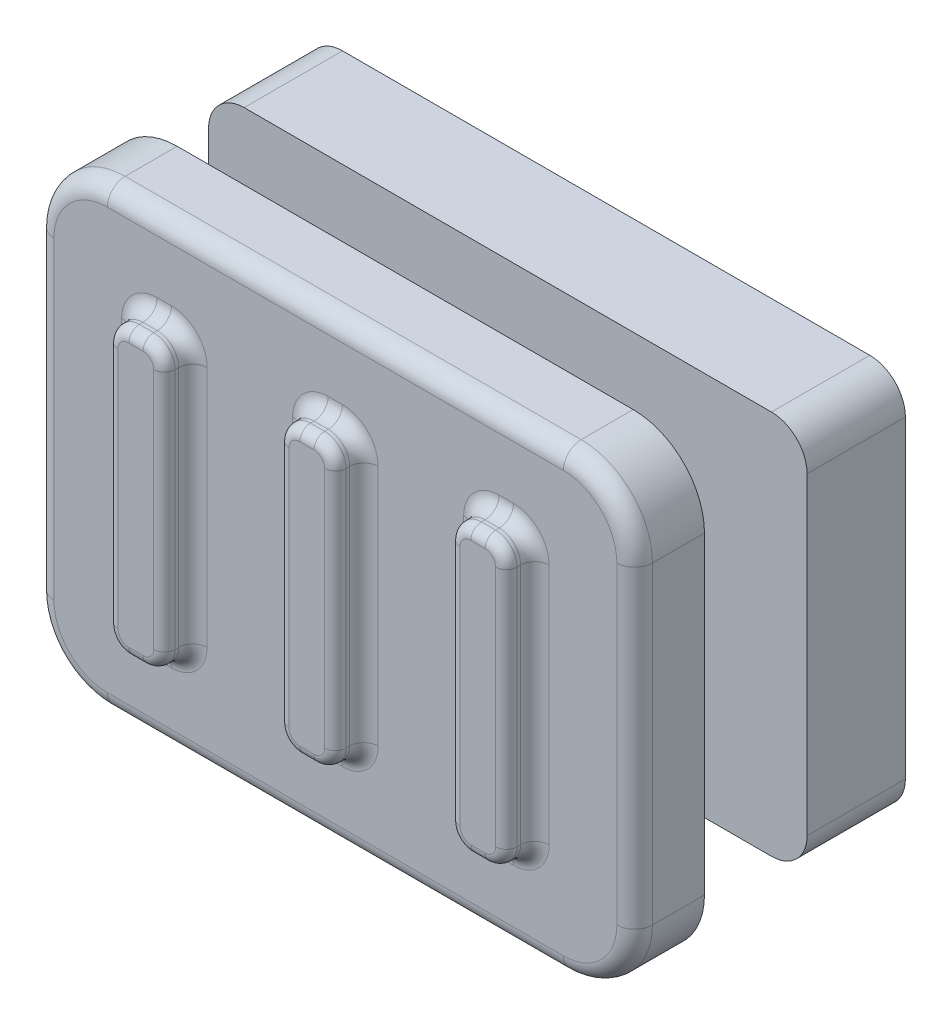
from build123d import *

# Parameters (mm, degrees)
SLIDER_STEM_DEPTH         = 4.2
CAPTIVE_FLANGE_START      = 1.2
CAPTIVE_FLANGE_DEPTH      = 1.38
THUMB_PAD_START           = 4.02
THUMB_PAD_DEPTH           = 0.98
SWITCH_PIN_SOCKET_START   = 2.3
SWITCH_PIN_SOCKET_DEPTH   = 2.4
PCB_EDGE_RELIEF_START     = 0.6
PCB_EDGE_RELIEF_PROFILE_W = 4
PCB_EDGE_RELIEF_PROFILE_H = 1.05
PCB_EDGE_RELIEF_DEPTH     = 0.7
STEM_SHOULDER_ROUND_R     = 0.2
THUMB_RIB_0_START         = 4.9
THUMB_RIB_0_DEPTH         = 0.5
THUMB_RIB_1_START         = 4.9
THUMB_RIB_1_DEPTH         = 0.5
THUMB_RIB_2_START         = 4.9
THUMB_RIB_2_DEPTH         = 0.5
THUMB_RIB_ROOT_ROUND_R    = 0.2
THUMB_PAD_EDGE_ROUND_R    = 0.25
THUMB_RIB_CROWN_ROUND_R   = 0.15


with BuildPart() as part:
    # Slider_stem_profile → Slider_stem (new body)
    with BuildSketch(Plane.XY):
        with BuildLine():
            Line((-1.5, -1.5), (1.5, -1.5))
            ThreePointArc((1.5, -1.5), (1.782842712, -1.382842712), (1.9, -1.1))
            Line((1.9, -1.1), (1.9, 1.1))
            ThreePointArc((1.9, 1.1), (1.782842712, 1.382842712), (1.5, 1.5))
            Line((1.5, 1.5), (-1.5, 1.5))
            ThreePointArc((-1.5, 1.5), (-1.782842712, 1.382842712), (-1.9, 1.1))
            Line((-1.9, 1.1), (-1.9, -1.1))
            ThreePointArc((-1.9, -1.1), (-1.782842712, -1.382842712), (-1.5, -1.5))
        make_face()
    extrude(amount=SLIDER_STEM_DEPTH)

    # Captive_flange_profile → Captive_flange (add)
    with BuildSketch(Plane.XY.offset(CAPTIVE_FLANGE_START)):
        with BuildLine():
            Line((-3.7, -2.7), (3.7, -2.7))
            ThreePointArc((3.7, -2.7), (4.053553391, -2.553553391), (4.2, -2.2))
            Line((4.2, -2.2), (4.2, 2.2))
            ThreePointArc((4.2, 2.2), (4.053553391, 2.553553391), (3.7, 2.7))
            Line((3.7, 2.7), (-3.7, 2.7))
            ThreePointArc((-3.7, 2.7), (-4.053553391, 2.553553391), (-4.2, 2.2))
            Line((-4.2, 2.2), (-4.2, -2.2))
            ThreePointArc((-4.2, -2.2), (-4.053553391, -2.553553391), (-3.7, -2.7))
        make_face()
    extrude(amount=CAPTIVE_FLANGE_DEPTH)

    # Thumb_pad_profile → Thumb_pad (add)
    with BuildSketch(Plane.XY.offset(THUMB_PAD_START)):
        with BuildLine():
            Line((-3.2, -3.2), (3.2, -3.2))
            ThreePointArc((3.2, -3.2), (3.907106781, -2.907106781), (4.2, -2.2))
            Line((4.2, -2.2), (4.2, 2.2))
            ThreePointArc((4.2, 2.2), (3.907106781, 2.907106781), (3.2, 3.2))
            Line((3.2, 3.2), (-3.2, 3.2))
            ThreePointArc((-3.2, 3.2), (-3.907106781, 2.907106781), (-4.2, 2.2))
            Line((-4.2, 2.2), (-4.2, -2.2))
            ThreePointArc((-4.2, -2.2), (-3.907106781, -2.907106781), (-3.2, -3.2))
        make_face()
    extrude(amount=THUMB_PAD_DEPTH)

    # Switch_pin_socket_profile → Switch_pin_socket (cut)
    with BuildSketch(Plane.XY.offset(SWITCH_PIN_SOCKET_START)):
        with BuildLine():
            Line((-0.725, -0.6), (0.725, -0.6))
            ThreePointArc((0.725, -0.6), (0.795710678, -0.570710678), (0.825, -0.5))
            Line((0.825, -0.5), (0.825, 0.5))
            ThreePointArc((0.825, 0.5), (0.795710678, 0.570710678), (0.725, 0.6))
            Line((0.725, 0.6), (-0.725, 0.6))
            ThreePointArc((-0.725, 0.6), (-0.795710678, 0.570710678), (-0.825, 0.5))
            Line((-0.825, 0.5), (-0.825, -0.5))
            ThreePointArc((-0.825, -0.5), (-0.795710678, -0.570710678), (-0.725, -0.6))
        make_face()
    extrude(amount=-SWITCH_PIN_SOCKET_DEPTH, mode=Mode.SUBTRACT)

    # PCB_edge_relief_profile → PCB_edge_relief (cut)
    with BuildSketch(Plane.XY.offset(PCB_EDGE_RELIEF_START)):
        with Locations((0, 1.075)):
            Rectangle(PCB_EDGE_RELIEF_PROFILE_W, PCB_EDGE_RELIEF_PROFILE_H)
    extrude(amount=-PCB_EDGE_RELIEF_DEPTH, mode=Mode.SUBTRACT)

    # Stem_shoulder_round
    stem_shoulder_round_edges = [part.edges().sort_by_distance(p)[0] for p in [
        (1.782842712, -1.382842712, 1.2),
        (-1.782842712, -1.382842712, 1.2),
        (-1.782842712, 1.382842712, 1.2),
        (1.782842712, 1.382842712, 1.2),
        (1.782842712, -1.382842712, 2.58),
        (-1.782842712, -1.382842712, 2.58),
        (-1.782842712, 1.382842712, 2.58),
        (1.782842712, 1.382842712, 2.58),
        (1.782842712, -1.382842712, 4.02),
        (-1.782842712, -1.382842712, 4.02),
        (-1.782842712, 1.382842712, 4.02),
        (1.782842712, 1.382842712, 4.02),
        (0, 1.5, 4.02),
        (0, 1.5, 1.2),
        (-1.9, 0, 1.2),
        (0, -1.5, 1.2),
        (1.9, 0, 1.2),
        (0, 1.5, 2.58),
        (-1.9, 0, 2.58),
        (-1.9, 0, 4.02),
        (0, -1.5, 2.58),
        (0, -1.5, 4.02),
        (1.9, 0, 2.58),
        (1.9, 0, 4.02),
    ]]
    fillet(stem_shoulder_round_edges, radius=STEM_SHOULDER_ROUND_R)

    # Thumb_rib_0_profile → Thumb_rib_0 (add)
    with BuildSketch(Plane.XY.offset(THUMB_RIB_0_START)):
        with BuildLine():
            Line((-2.5, -2), (-2.3, -2))
            ThreePointArc((-2.3, -2), (-2.087867966, -1.912132034), (-2, -1.7))
            Line((-2, -1.7), (-2, 1.7))
            ThreePointArc((-2, 1.7), (-2.087867966, 1.912132034), (-2.3, 2))
            Line((-2.3, 2), (-2.5, 2))
            ThreePointArc((-2.5, 2), (-2.712132034, 1.912132034), (-2.8, 1.7))
            Line((-2.8, 1.7), (-2.8, -1.7))
            ThreePointArc((-2.8, -1.7), (-2.712132034, -1.912132034), (-2.5, -2))
        make_face()
    extrude(amount=THUMB_RIB_0_DEPTH)

    # Thumb_rib_1_profile → Thumb_rib_1 (add)
    with BuildSketch(Plane.XY.offset(THUMB_RIB_1_START)):
        with BuildLine():
            Line((-0.1, -2), (0.1, -2))
            ThreePointArc((0.1, -2), (0.312132034, -1.912132034), (0.4, -1.7))
            Line((0.4, -1.7), (0.4, 1.7))
            ThreePointArc((0.4, 1.7), (0.312132034, 1.912132034), (0.1, 2))
            Line((0.1, 2), (-0.1, 2))
            ThreePointArc((-0.1, 2), (-0.312132034, 1.912132034), (-0.4, 1.7))
            Line((-0.4, 1.7), (-0.4, -1.7))
            ThreePointArc((-0.4, -1.7), (-0.312132034, -1.912132034), (-0.1, -2))
        make_face()
    extrude(amount=THUMB_RIB_1_DEPTH)

    # Thumb_rib_2_profile → Thumb_rib_2 (add)
    with BuildSketch(Plane.XY.offset(THUMB_RIB_2_START)):
        with BuildLine():
            Line((2.3, -2), (2.5, -2))
            ThreePointArc((2.5, -2), (2.712132034, -1.912132034), (2.8, -1.7))
            Line((2.8, -1.7), (2.8, 1.7))
            ThreePointArc((2.8, 1.7), (2.712132034, 1.912132034), (2.5, 2))
            Line((2.5, 2), (2.3, 2))
            ThreePointArc((2.3, 2), (2.087867966, 1.912132034), (2, 1.7))
            Line((2, 1.7), (2, -1.7))
            ThreePointArc((2, -1.7), (2.087867966, -1.912132034), (2.3, -2))
        make_face()
    extrude(amount=THUMB_RIB_2_DEPTH)

    # Thumb_rib_root_round
    thumb_rib_root_round_edges = [part.edges().sort_by_distance(p)[0] for p in [
        (2.087867966, -1.912132034, 5),
        (2.4, -2, 5),
        (2.712132034, -1.912132034, 5),
        (2.712132034, 1.912132034, 5),
        (2.4, 2, 5),
        (2.087867966, 1.912132034, 5),
        (-0.312132034, -1.912132034, 5),
        (0, -2, 5),
        (0.312132034, -1.912132034, 5),
        (0.312132034, 1.912132034, 5),
        (0, 2, 5),
        (-0.312132034, 1.912132034, 5),
        (-2.712132034, -1.912132034, 5),
        (-2.4, -2, 5),
        (-2.087867966, -1.912132034, 5),
        (-2.087867966, 1.912132034, 5),
        (-2.4, 2, 5),
        (-2.712132034, 1.912132034, 5),
        (2.8, 0, 5),
        (2, 0, 5),
        (0.4, 0, 5),
        (-0.4, 0, 5),
        (-2, 0, 5),
        (-2.8, 0, 5),
    ]]
    fillet(thumb_rib_root_round_edges, radius=THUMB_RIB_ROOT_ROUND_R)

    # Thumb_pad_edge_round
    thumb_pad_edge_round_edges = [part.edges().sort_by_distance(p)[0] for p in [
        (4.2, 0, 5),
        (3.907106781, -2.907106781, 5),
        (3.907106781, 2.907106781, 5),
        (0, -3.2, 5),
        (0, 3.2, 5),
        (-3.907106781, -2.907106781, 5),
        (-3.907106781, 2.907106781, 5),
        (-4.2, 0, 5),
    ]]
    fillet(thumb_pad_edge_round_edges, radius=THUMB_PAD_EDGE_ROUND_R)

    # Thumb_rib_crown_round
    thumb_rib_crown_round_edges = [part.edges().sort_by_distance(p)[0] for p in [
        (2.8, 0, 5.4),
        (2.712132034, 1.912132034, 5.4),
        (2.712132034, -1.912132034, 5.4),
        (2.4, 2, 5.4),
        (2.4, -2, 5.4),
        (2.087867966, 1.912132034, 5.4),
        (2.087867966, -1.912132034, 5.4),
        (2, 0, 5.4),
        (0.4, 0, 5.4),
        (0.312132034, 1.912132034, 5.4),
        (0.312132034, -1.912132034, 5.4),
        (0, 2, 5.4),
        (0, -2, 5.4),
        (-0.312132034, 1.912132034, 5.4),
        (-0.312132034, -1.912132034, 5.4),
        (-0.4, 0, 5.4),
        (-2, 0, 5.4),
        (-2.087867966, 1.912132034, 5.4),
        (-2.087867966, -1.912132034, 5.4),
        (-2.4, 2, 5.4),
        (-2.4, -2, 5.4),
        (-2.712132034, 1.912132034, 5.4),
        (-2.712132034, -1.912132034, 5.4),
        (-2.8, 0, 5.4),
    ]]
    fillet(thumb_rib_crown_round_edges, radius=THUMB_RIB_CROWN_ROUND_R)


solid = part.part
